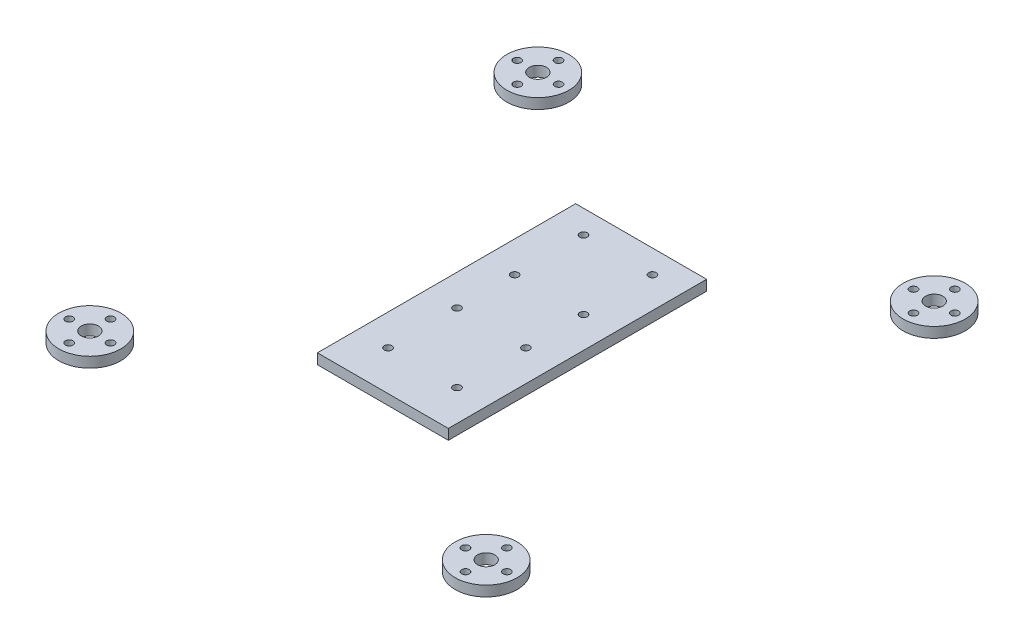
from build123d import *

# Parameters (mm, degrees)
SKETCH1_R             = 9
SKETCH1_R_2           = 1.1
SKETCH1_R_3           = 2.5
BOSS_EXTRUDE1_DEPTH   = 3
BOSS_EXTRUDE1_2_DEPTH = 3
BOSS_EXTRUDE1_3_DEPTH = 3
BOSS_EXTRUDE1_4_DEPTH = 3
SKETCH1_W             = 38
SKETCH1_H             = 74.95
BOSS_EXTRUDE1_5_DEPTH = 3


with BuildPart() as part:
    # Sketch1 → Boss-Extrude1 (new body)
    with BuildSketch(Plane(origin=(0, 0, 0), x_dir=(1, 0, 0), z_dir=(0, 1, 0))):
        with Locations((-57.5, 65)):
            Circle(SKETCH1_R)
        with Locations((-57.5, 71)):
            Circle(SKETCH1_R_2, mode=Mode.SUBTRACT)
        with Locations((-63.5, 65)):
            Circle(SKETCH1_R_2, mode=Mode.SUBTRACT)
        with Locations((-57.5, 59)):
            Circle(SKETCH1_R_2, mode=Mode.SUBTRACT)
        with Locations((-51.5, 65)):
            Circle(SKETCH1_R_2, mode=Mode.SUBTRACT)
        with Locations((-57.5, 65)):
            Circle(SKETCH1_R_3, mode=Mode.SUBTRACT)
    extrude(amount=BOSS_EXTRUDE1_DEPTH)


with BuildPart() as body_2:
    # Sketch1 → Boss-Extrude1 2 (new body)
    with BuildSketch(Plane(origin=(0, 0, 0), x_dir=(1, 0, 0), z_dir=(0, 1, 0))):
        with Locations((57.5, 65)):
            Circle(SKETCH1_R)
        with Locations((57.5, 59)):
            Circle(SKETCH1_R_2, mode=Mode.SUBTRACT)
        with Locations((51.5, 65)):
            Circle(SKETCH1_R_2, mode=Mode.SUBTRACT)
        with Locations((57.5, 71)):
            Circle(SKETCH1_R_2, mode=Mode.SUBTRACT)
        with Locations((63.5, 65)):
            Circle(SKETCH1_R_2, mode=Mode.SUBTRACT)
        with Locations((57.5, 65)):
            Circle(SKETCH1_R_3, mode=Mode.SUBTRACT)
    extrude(amount=BOSS_EXTRUDE1_2_DEPTH)


with BuildPart() as body_3:
    # Sketch1 → Boss-Extrude1 3 (new body)
    with BuildSketch(Plane(origin=(0, 0, 0), x_dir=(1, 0, 0), z_dir=(0, 1, 0))):
        with Locations((57.5, -65)):
            Circle(SKETCH1_R)
        with Locations((51.5, -65)):
            Circle(SKETCH1_R_2, mode=Mode.SUBTRACT)
        with Locations((57.5, -59)):
            Circle(SKETCH1_R_2, mode=Mode.SUBTRACT)
        with Locations((63.5, -65)):
            Circle(SKETCH1_R_2, mode=Mode.SUBTRACT)
        with Locations((57.5, -71)):
            Circle(SKETCH1_R_2, mode=Mode.SUBTRACT)
        with Locations((57.5, -65)):
            Circle(SKETCH1_R_3, mode=Mode.SUBTRACT)
    extrude(amount=BOSS_EXTRUDE1_3_DEPTH)


with BuildPart() as body_4:
    # Sketch1 → Boss-Extrude1 4 (new body)
    with BuildSketch(Plane(origin=(0, 0, 0), x_dir=(1, 0, 0), z_dir=(0, 1, 0))):
        with Locations((-57.5, -65)):
            Circle(SKETCH1_R)
        with Locations((-57.5, -59)):
            Circle(SKETCH1_R_2, mode=Mode.SUBTRACT)
        with Locations((-51.5, -65)):
            Circle(SKETCH1_R_2, mode=Mode.SUBTRACT)
        with Locations((-57.5, -71)):
            Circle(SKETCH1_R_2, mode=Mode.SUBTRACT)
        with Locations((-63.5, -65)):
            Circle(SKETCH1_R_2, mode=Mode.SUBTRACT)
        with Locations((-57.5, -65)):
            Circle(SKETCH1_R_3, mode=Mode.SUBTRACT)
    extrude(amount=BOSS_EXTRUDE1_4_DEPTH)


with BuildPart() as body_5:
    # Sketch1 → Boss-Extrude1 5 (new body)
    with BuildSketch(Plane(origin=(0, 0, 0), x_dir=(1, 0, 0), z_dir=(0, 1, 0))):
        Rectangle(SKETCH1_W, SKETCH1_H)
        with Locations((-10, 30.75)):
            Circle(SKETCH1_R_2, mode=Mode.SUBTRACT)
        with Locations((10, 30.75)):
            Circle(SKETCH1_R_2, mode=Mode.SUBTRACT)
        with Locations((10, 10.75)):
            Circle(SKETCH1_R_2, mode=Mode.SUBTRACT)
        with Locations((-10, 10.75)):
            Circle(SKETCH1_R_2, mode=Mode.SUBTRACT)
        with Locations((-10, -5.975)):
            Circle(SKETCH1_R_2, mode=Mode.SUBTRACT)
        with Locations((10, -5.975)):
            Circle(SKETCH1_R_2, mode=Mode.SUBTRACT)
        with Locations((10, -25.975)):
            Circle(SKETCH1_R_2, mode=Mode.SUBTRACT)
        with Locations((-10, -25.975)):
            Circle(SKETCH1_R_2, mode=Mode.SUBTRACT)
    extrude(amount=BOSS_EXTRUDE1_5_DEPTH)


solid = Compound([part.part, body_2.part, body_3.part, body_4.part, body_5.part])
